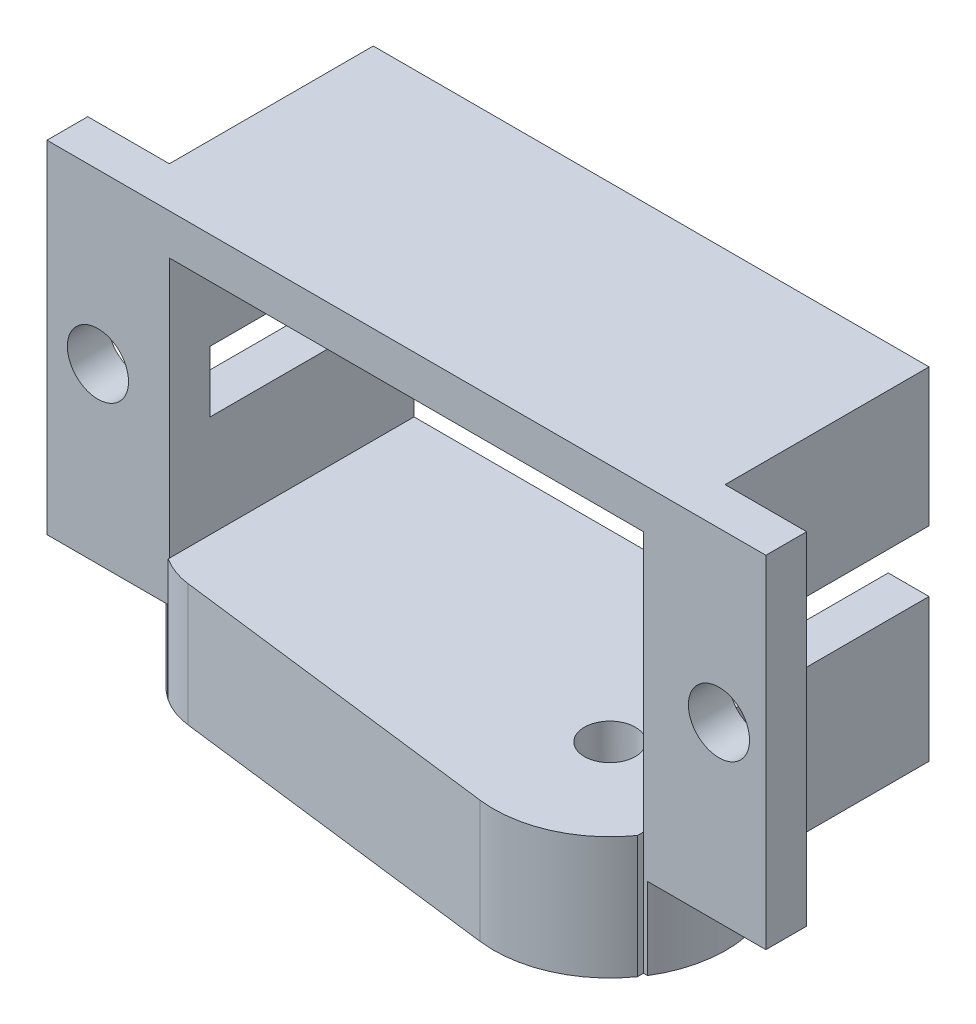
from build123d import *

# Parameters (mm, degrees)
SKETCH1_W           = 27.25
SKETCH1_H           = 16.75
SKETCH1_W_2         = 23.25
SKETCH1_H_2         = 12.75
BOSS_EXTRUDE1_DEPTH = 18
SKETCH3_W           = 23.25
SKETCH3_H           = 12.75
BOSS_EXTRUDE2_DEPTH = 2
SKETCH7_W           = 2
SKETCH7_H           = 5
CUT_EXTRUDE1_DEPTH  = 2
SKETCH10_W          = 23.25
SKETCH10_H          = 12.75
SKETCH10_W_2        = 7
SKETCH10_H_2        = 16.75
BOSS_EXTRUDE3_DEPTH = 2
SKETCH11_R          = 1.5
CUT_EXTRUDE3_DEPTH  = 2
SKETCH12_R          = 1.5
CUT_EXTRUDE4_DEPTH  = 2
FILLET11_R          = 1
SKETCH13_W          = 3
SKETCH13_H          = 16.75
CUT_EXTRUDE5_DEPTH  = 10
CUT_EXTRUDE6_REACH  = 41.193
SKETCH14_W          = 27.25
SKETCH14_H          = 8
SKETCH16_W          = 23.25
SKETCH16_H          = 2
BOSS_EXTRUDE5_DEPTH = 7.6
SKETCH19_W          = 2
SKETCH19_H          = 3
CUT_EXTRUDE8_DEPTH  = 10
BOSS_EXTRUDE6_DEPTH = 4
SKETCH21_R          = 1.25
CUT_EXTRUDE9_DEPTH  = 2
BOSS_EXTRUDE7_DEPTH = 1
CUT_EXTRUDE11_START = -12
CUT_EXTRUDE11_DEPTH = 12


with BuildPart() as part:
    # Sketch1 → Boss-Extrude1 (new body)
    with BuildSketch(Plane.XY):
        with Locations((11.625, -6.375)):
            Rectangle(SKETCH1_W, SKETCH1_H)
        with Locations((11.625, -6.375)):
            Rectangle(SKETCH1_W_2, SKETCH1_H_2, mode=Mode.SUBTRACT)
    extrude(amount=BOSS_EXTRUDE1_DEPTH)

    # Sketch3 → Boss-Extrude2 (add)
    with BuildSketch(Plane(origin=(0, 0, 0), x_dir=(-1, 0, 0), z_dir=(0, 0, -1))):
        with Locations((-11.625, -6.375)):
            Rectangle(SKETCH3_W, SKETCH3_H)
    extrude(amount=-BOSS_EXTRUDE2_DEPTH)

    # Sketch7 → Cut-Extrude1 (cut)
    with BuildSketch(Plane.ZY.offset(2)):
        with Locations((3, -6.5)):
            Rectangle(SKETCH7_W, SKETCH7_H)
    extrude(amount=-CUT_EXTRUDE1_DEPTH, mode=Mode.SUBTRACT)

    # Sketch10 → Boss-Extrude3 (add)
    # profile 1 of 3: a face of its own
    with BuildSketch(Plane.XY.offset(18)):
        Polygon((-2, -0.03961342), (-2, 2), (-9, 2), (-9, -14.75), (-2, -14.75), (-2, -13.03961342), align=None)
    # profile 2 of 3: a face of its own
    with BuildSketch(Plane.XY.offset(18)):
        Polygon((25.25, 2), (-2, 2), (-2, -0.03961342), (-2, -13.03961342), (-2, -14.75), (25.25, -14.75), align=None)
        with Locations((11.625, -6.375)):
            Rectangle(SKETCH10_W, SKETCH10_H, mode=Mode.SUBTRACT)
    # profile 3 of 3: a face of its own
    with BuildSketch(Plane.XY.offset(18)):
        with Locations((28.75, -6.375)):
            Rectangle(SKETCH10_W_2, SKETCH10_H_2)
    extrude(amount=BOSS_EXTRUDE3_DEPTH)

    # Sketch11 → Cut-Extrude3 (cut)
    with BuildSketch(Plane(origin=(0, 0, 18), x_dir=(-1, 0, 0), z_dir=(0, 0, -1))):
        with Locations((3.5, -6.25)):
            Circle(SKETCH11_R)
    extrude(amount=-CUT_EXTRUDE3_DEPTH, mode=Mode.SUBTRACT)

    # Sketch12 → Cut-Extrude4 (cut)
    with BuildSketch(Plane(origin=(0, 0, 18), x_dir=(-1, 0, 0), z_dir=(0, 0, -1))):
        with Locations((-26.95, -6.25)):
            Circle(SKETCH12_R)
    extrude(amount=-CUT_EXTRUDE4_DEPTH, mode=Mode.SUBTRACT)

    # Fillet11
    fillet11_edges = [part.edges().sort_by_distance(p)[0] for p in [
        (0, -9, 3),
        (0, -4, 3),
        (0, -6.5, 4),
        (-2, -6.5, 4),
        (-2, -4, 3),
        (-2, -9, 3),
    ]]
    fillet(fillet11_edges, radius=FILLET11_R - 0.0001)  # a hair under: the kernel refuses the full size

    # Sketch13 → Cut-Extrude5 (cut)
    with BuildSketch(Plane(origin=(0, 0, 18), x_dir=(-1, 0, 0), z_dir=(0, 0, -1))):
        with Locations((-30.75, -6.375)):
            Rectangle(SKETCH13_W, SKETCH13_H)
        with Locations((7.5, -6.375)):
            Rectangle(SKETCH13_W, SKETCH13_H)
    extrude(amount=-CUT_EXTRUDE5_DEPTH, mode=Mode.SUBTRACT)

    # Cut-Extrude6: up to this face of the body (flat: up to its plane)
    cut_extrude6_end = Plane(part.part.faces().sort_by_distance((11.625, -14.75, 10.256684492))[0])
    # Sketch14 → Cut-Extrude6 (cut, up to the picked face)
    with BuildSketch(Plane(origin=(0, 2, 0), x_dir=(1, 0, 0), z_dir=(0, 1, 0)), mode=Mode.PRIVATE) as cut_extrude6_sk1:
        with Locations((11.625, -4)):
            Rectangle(SKETCH14_W, SKETCH14_H)
    cut_extrude6_tool1 = split(extrude(cut_extrude6_sk1.sketch, amount=-CUT_EXTRUDE6_REACH, mode=Mode.PRIVATE), bisect_by=cut_extrude6_end, keep=Keep.BOTH, mode=Mode.PRIVATE)
    add(cut_extrude6_tool1.solids().sort_by(Axis((11.625, 2, 4), (0, -1, 0)))[0], mode=Mode.SUBTRACT)

    # Sketch16 → Boss-Extrude5 (add)
    with BuildSketch(Plane.XY.offset(20)):
        with Locations((11.625, -13.75)):
            Rectangle(SKETCH16_W, SKETCH16_H)
    extrude(amount=BOSS_EXTRUDE5_DEPTH)

    # Sketch19 → Cut-Extrude8 (cut)
    with BuildSketch(Plane(origin=(0, 0, 8), x_dir=(-1, 0, 0), z_dir=(0, 0, -1))):
        with Locations((1, -6.25)):
            Rectangle(SKETCH19_W, SKETCH19_H)
        with Locations((-24.25, -6.25)):
            Rectangle(SKETCH19_W, SKETCH19_H)
    extrude(amount=-CUT_EXTRUDE8_DEPTH, mode=Mode.SUBTRACT)

    # Sketch20 → Boss-Extrude6 (add)
    with BuildSketch(Plane.XZ.offset(14.75)):
        with BuildLine():
            ThreePointArc((1.734487906, 14.866457564), (-0.15, 17.000000025), (1.734487955, 19.133542442))
            Line((1.734487955, 19.133542442), (4.661486136, 19.497797339))
            ThreePointArc((4.661486136, 19.497797339), (3.240091566, 20.432881138), (1.549246975, 20.622060423))
            ThreePointArc((1.549246975, 20.622060423), (0.742054746, 20.4263791), (0, 20.053276928))
            Line((0, 20.053276928), (0, 20))
            Line((0, 20), (-0.079062289, 20))
            ThreePointArc((-0.079062289, 20), (-1.544419903, 16.128456799), (1.549246968, 13.377939578))
            ThreePointArc((1.549246968, 13.377939578), (3.240091563, 13.567118861), (4.661486136, 14.502202661))
            Line((4.661486136, 14.502202661), (1.734487906, 14.866457564))
        make_face()
        with BuildLine():
            ThreePointArc((1.549246975, 20.622060423), (3.240091566, 20.432881138), (4.661486136, 19.497797339))
            Line((4.661486136, 19.497797339), (14.257253364, 20.691957699))
            ThreePointArc((14.257253364, 20.691957699), (15.89224684, 22.015782374), (17.896084422, 22.656368345))
            Line((17.896084422, 22.656368345), (1.549246975, 20.622060423))
        make_face()
        with BuildLine():
            ThreePointArc((17.896084422, 22.656368345), (15.89224684, 22.015782374), (14.257253364, 20.691957699))
            Line((14.257253364, 20.691957699), (18.081325153, 21.167850334))
            ThreePointArc((18.081325153, 21.167850334), (21.380428532, 20.14789091), (22.8, 17))
            ThreePointArc((22.8, 17), (21.380428595, 13.852109147), (18.081325321, 12.832149645))
            Line((18.081325321, 12.832149645), (14.257253364, 13.308042301))
            ThreePointArc((14.257253364, 13.308042301), (15.89224684, 11.984217626), (17.896084422, 11.343631655))
            ThreePointArc((17.896084422, 11.343631655), (22.37343883, 12.727862432), (24.3, 17))
            ThreePointArc((24.3, 17), (24.082512903, 18.559503854), (23.446648326, 20))
            Line((23.446648326, 20), (23.25, 20))
            Line((23.25, 20), (23.25, 20.296589146))
            ThreePointArc((23.25, 20.296589146), (20.898920406, 22.215837897), (17.896084422, 22.656368345))
        make_face()
        with BuildLine():
            Line((14.257253364, 13.308042301), (4.661486136, 14.502202661))
            ThreePointArc((4.661486136, 14.502202661), (3.240091563, 13.567118861), (1.549246968, 13.377939578))
            Line((1.549246968, 13.377939578), (17.896084422, 11.343631655))
            ThreePointArc((17.896084422, 11.343631655), (15.89224684, 11.984217626), (14.257253364, 13.308042301))
        make_face()
    extrude(amount=BOSS_EXTRUDE6_DEPTH)

    # Sketch21 → Cut-Extrude9 (cut)
    with BuildSketch(Plane.XZ.offset(14.75)):
        with Locations((18.6, 17)):
            Circle(SKETCH21_R)
    extrude(amount=-CUT_EXTRUDE9_DEPTH, mode=Mode.SUBTRACT)

    # Sketch23 → Boss-Extrude7 (add)
    with BuildSketch(Plane.XZ.offset(14.75)):
        Polygon((11.1, 21.100651295), (0.406174607, 19.998863224), (-0.954500861, 17.320033397), (0.387681288, 14.425953139), (11.1, 12.86779769), align=None)
    extrude(amount=BOSS_EXTRUDE7_DEPTH)

    # Sketch24 → Cut-Extrude11 (cut)
    with BuildSketch(Plane.XZ.offset(14.75).offset(CUT_EXTRUDE11_START)):
        with BuildLine():
            ThreePointArc((0, 20.053276928), (0.742054739, 20.426379098), (1.549246961, 20.622060422))
            Line((1.549246961, 20.622060422), (17.896084422, 22.656368345))
            ThreePointArc((17.896084422, 22.656368345), (20.898920406, 22.215837897), (23.25, 20.296589146))
            Line((23.25, 20.296589146), (23.25, 27.6))
            Line((23.25, 27.6), (0, 27.6))
            Line((0, 27.6), (0, 20.053276928))
        make_face()
    extrude(amount=CUT_EXTRUDE11_DEPTH, mode=Mode.SUBTRACT)


solid = part.part
